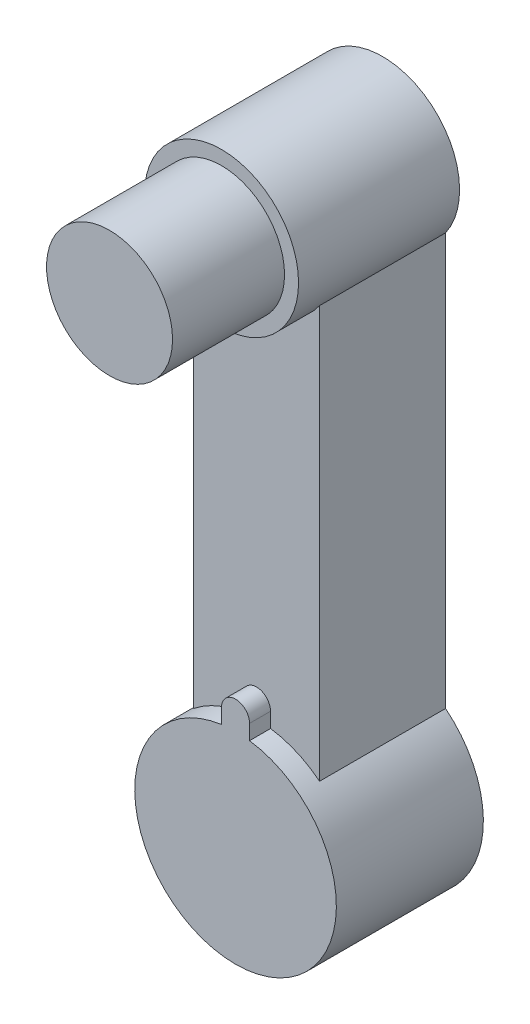
from build123d import *

# Parameters (mm, degrees)
BOSS_EXTRUDE5_DEPTH = 90
BOSS_EXTRUDE6_DEPTH = 115
BOSS_EXTRUDE7_DEPTH = 105
BOSS_EXTRUDE8_DEPTH = 15
SKETCH17_R          = 45
BOSS_EXTRUDE9_DEPTH = 80


with BuildPart() as part:
    # Sketch11 → Boss-Extrude5 (new body)
    with BuildSketch(Plane.XY):
        with BuildLine():
            ThreePointArc((-45, 56.204981986), (0, 72), (45, 56.204981986))
            Line((45, 56.204981986), (45, 350.377223398))
            ThreePointArc((45, 350.377223398), (0, 327), (-45, 350.377223398))
            Line((-45, 350.377223398), (-45, 56.204981986))
        make_face()
    extrude(amount=BOSS_EXTRUDE5_DEPTH)

    # Sketch11<3> → Boss-Extrude6 (add)
    with BuildSketch(Plane.XY):
        with BuildLine():
            ThreePointArc((-45, 350.377223398), (0, 327), (45, 350.377223398))
            ThreePointArc((45, 350.377223398), (52.440442409, 365.416876048), (55, 382))
            ThreePointArc((55, 382), (-16.583123952, 434.440442409), (-45, 350.377223398))
        make_face()
    extrude(amount=BOSS_EXTRUDE6_DEPTH)

    # Sketch11<4> → Boss-Extrude7 (add)
    with BuildSketch(Plane.XY):
        with BuildLine():
            ThreePointArc((72, 0), (64.899922958, 31.176914536), (45, 56.204981986))
            ThreePointArc((45, 56.204981986), (0, 72), (-45, 56.204981986))
            ThreePointArc((-45, 56.204981986), (-31.176914536, -64.899922958), (72, 0))
        make_face()
    extrude(amount=BOSS_EXTRUDE7_DEPTH)

    # Sketch13 → Boss-Extrude8 (add)
    with BuildSketch(Plane.XY.offset(90)):
        with BuildLine():
            Line((10, 82), (10, 71.30217388))
            Line((10, 71.30217388), (-10, 71.30217388))
            Line((-10, 71.30217388), (-10, 82))
            ThreePointArc((-10, 82), (0, 92), (10, 82))
        make_face()
    extrude(amount=BOSS_EXTRUDE8_DEPTH)

    # Sketch17 → Boss-Extrude9 (add)
    with BuildSketch(Plane.XY.offset(115)):
        with Locations((0, 382)):
            Circle(SKETCH17_R)
    extrude(amount=BOSS_EXTRUDE9_DEPTH)


solid = part.part
